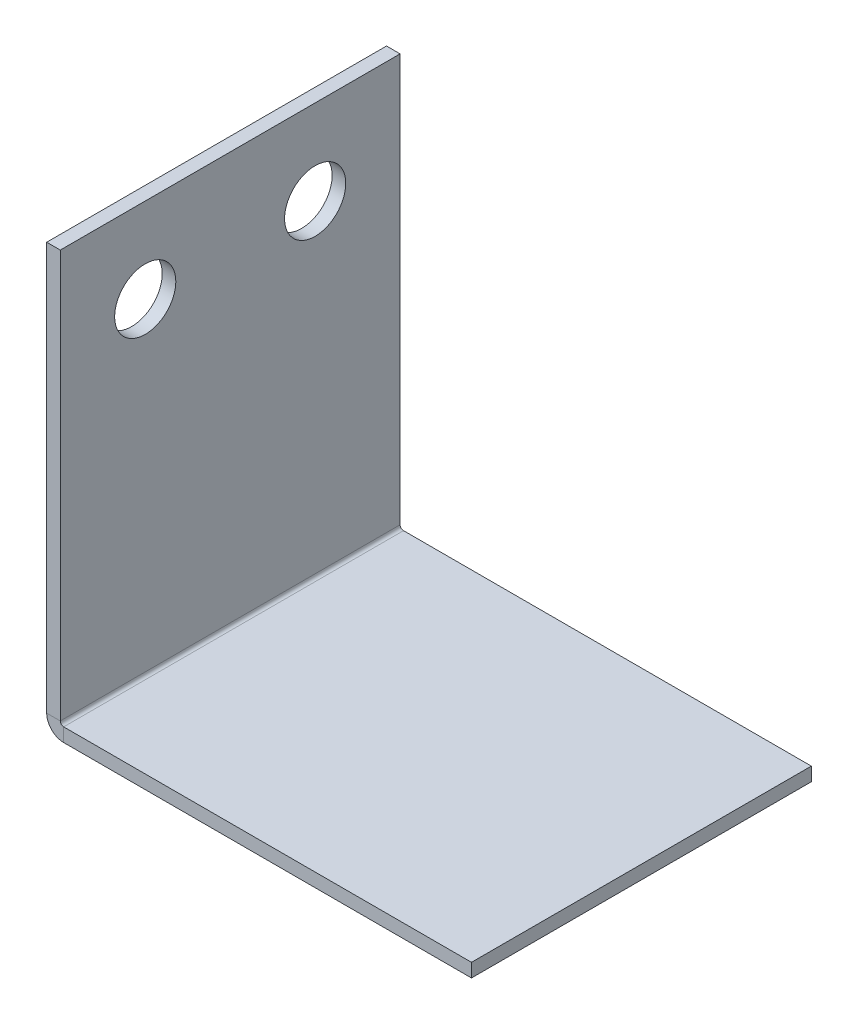
from build123d import *

# Parameters (mm, degrees)
SM_BASE_FLANGE_1_DEPTH = 100
SKETCH_6_R             = 9
CUT_EXTRUDE_1_DEPTH    = 10


# Sheet-metal steps are written as plain solids
with BuildPart() as part:
    # Sketch 1 → Базовая кромка1 (new body)
    with BuildSketch(Plane.XY):
        with BuildLine():
            Line((0, 0), (0, -120))
            ThreePointArc((0, -120), (1.464466094, -123.535533906), (5, -125))
            Line((5, -125), (125, -125))
            Line((125, -125), (125, -121))
            Line((125, -121), (5, -121))
            ThreePointArc((5, -121), (4.292893219, -120.707106781), (4, -120))
            Line((4, -120), (4, 0))
            Line((4, 0), (0, 0))
        make_face()
    extrude(amount=SM_BASE_FLANGE_1_DEPTH)

    # Эскиз6 → Вырез-Вытянуть1 (cut)
    with BuildSketch(Plane(origin=(4, 0, 0), x_dir=(0, 0, -1), z_dir=(1, 0, 0))):
        with Locations(Location((-75, -25, 0), (0, 0, 90))):
            Circle(SKETCH_6_R)
        with Locations(Location((-25, -25, 0), (0, 0, 90))):
            Circle(SKETCH_6_R)
    extrude(amount=-CUT_EXTRUDE_1_DEPTH, mode=Mode.SUBTRACT)


solid = part.part
